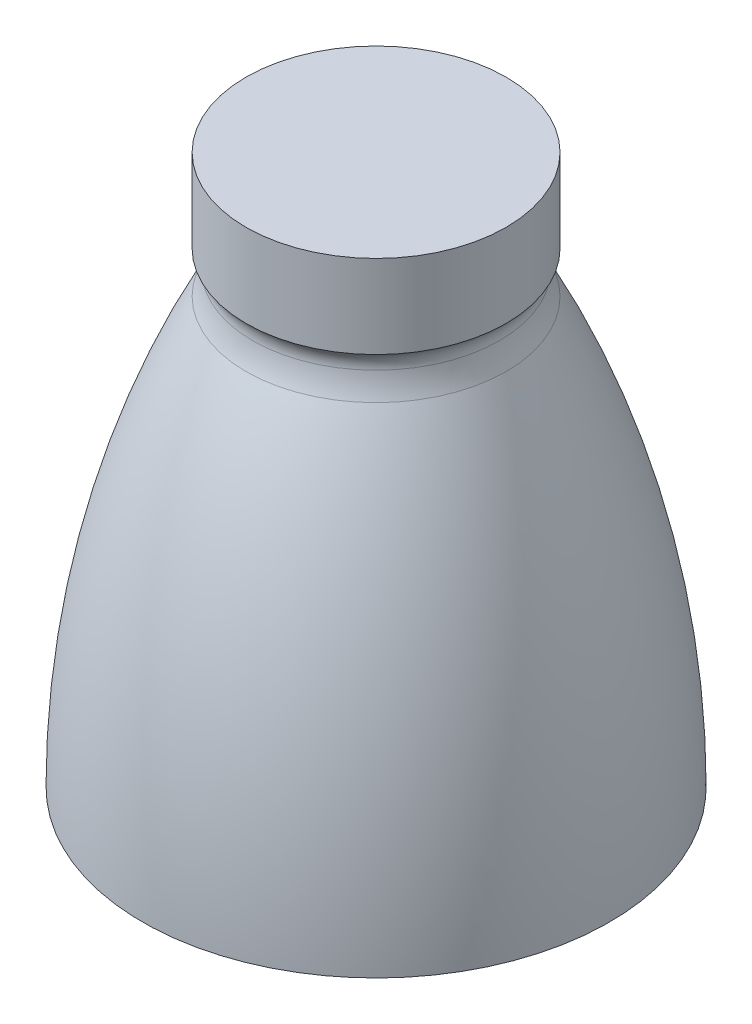
from build123d import *

# Parameters (mm, degrees)
SKETCH2_R           = 2.945157041
BOSS_EXTRUDE1_DEPTH = 1
SKETCH3_R           = 3.125
BOSS_EXTRUDE2_DEPTH = 2
FILLET1_R           = 2
FILLET2_R           = 0.5


with BuildPart() as part:
    # Sketch1 → Revolve1 (revolve)
    with BuildSketch(Plane.XY, mode=Mode.PRIVATE) as revolve1_sk:
        with BuildLine():
            Line((2.790292922, 0), (3.125, 0))
            ThreePointArc((3.125, 0), (4.976777415, -4.958274435), (5.60588742, -10.213537089))
            Line((5.60588742, -10.213537089), (5.11812749, -10.213537089))
            ThreePointArc((5.11812749, -10.213537089), (4.52880139, -4.97580968), (2.790292922, 0))
        make_face()
    revolve(revolve1_sk.sketch.rotate(Axis((0, -10.213537089, 0), (0, 1, 0)), 90), axis=Axis((0, -10.213537089, 0), (0, 1, 0)))

    # Sketch2 → Boss-Extrude1 (add)
    with BuildSketch(Plane(origin=(0, 0, 0), x_dir=(1, 0, 0), z_dir=(0, 1, 0))):
        with Locations(Location((0, 0, 0), (0, 0, 270))):
            Circle(SKETCH2_R)
    extrude(amount=BOSS_EXTRUDE1_DEPTH)

    # Sketch3 → Boss-Extrude2 (add)
    with BuildSketch(Plane(origin=(0, 1, 0), x_dir=(1, 0, 0), z_dir=(0, 1, 0))):
        with Locations(Location((0, 0, 0), (0, 0, 270))):
            Circle(SKETCH3_R)
    extrude(amount=BOSS_EXTRUDE2_DEPTH)

    # Fillet1
    # the kernel refuses this fillet: 2 mm, written as the material it adds along each edge
    with BuildSketch(Plane(origin=(0, 0, 0), x_dir=(0, 0, 1), z_dir=(-1, 0, 0))) as fillet1_piece_1:
        with BuildLine():
            CenterArc((4.945157041, 0.828871731), FILLET1_R, 180, 24.483795265)
            Line((3.125, 0), (2.945157041, 0))
            Line((2.945157041, 0), (2.945157041, 0.828871731))
        make_face()
    revolve(axis=Axis((0, 0, 0), (0, 1, 0)))

    # Fillet2
    # the kernel refuses this fillet: 0.5 mm, written as the material it adds along each edge
    with BuildSketch(Plane(origin=(0, 1, 0), x_dir=(0, 0, 1), z_dir=(-1, 0, 0))) as fillet2_piece_1:
        with BuildLine():
            CenterArc((3.458713381, -0.372337723), FILLET2_R, 131.868770298, 55.840101838)
            Line((3.125, 0), (3.091628662, 0.037233772))
            ThreePointArc((3.091628662, 0.037233772), (3.035078521, 0.05), (2.945157041, 0.05))
            Line((2.945157041, 0.05), (2.895157041, 0))
            ThreePointArc((2.895157041, 0), (2.895157041, -0.171128269), (2.913684038, -0.446114522))
            Line((2.913684038, -0.446114522), (2.96323216, -0.43940754))
        make_face()
    revolve(axis=Axis((0, 1, 0), (0, 1, 0)))


solid = part.part
